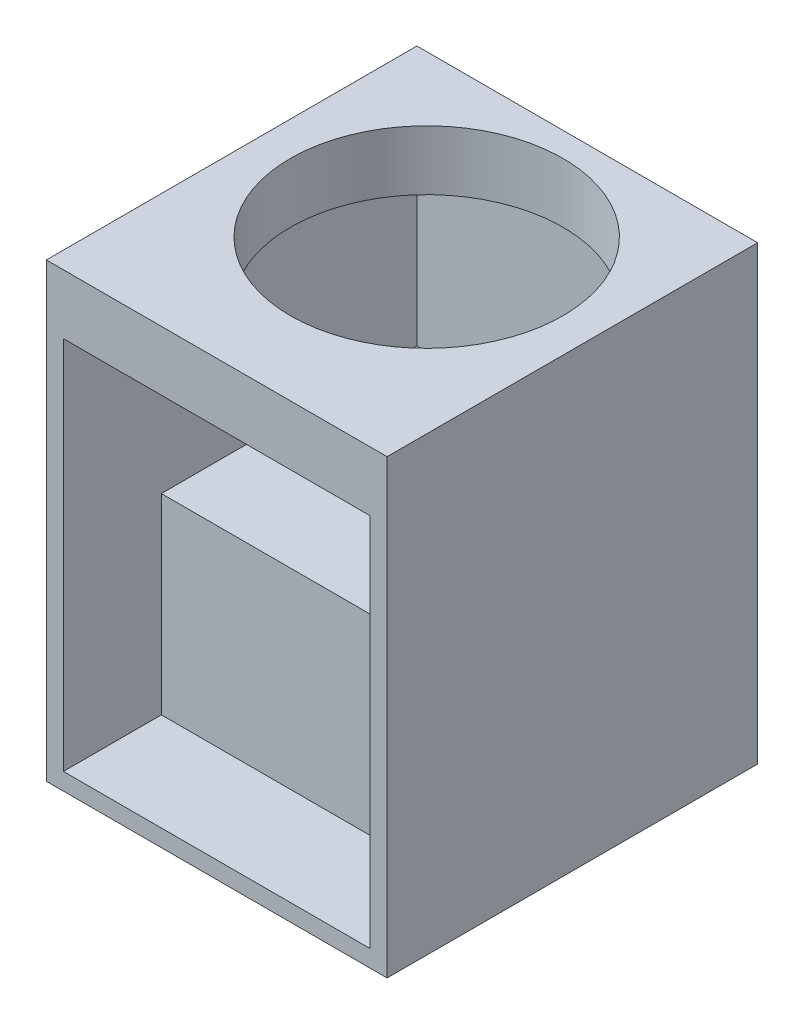
from build123d import *

# Parameters (mm, degrees)
SKETCH1_W           = 400
SKETCH1_H           = 435
BOSS_EXTRUDE1_DEPTH = 480
SKETCH4_W           = 350
SKETCH4_H           = 200
CUT_EXTRUDE1_DEPTH  = 300
SHELL1_START        = -180
SHELL1_DEPTH        = 360
SKETCH5_W           = 400
SKETCH5_H           = 435
BOSS_EXTRUDE2_DEPTH = 50
SKETCH3_R           = 160
CUT_EXTRUDE2_DEPTH  = 70
SKETCH6_R           = 42.5
CUT_EXTRUDE3_DEPTH  = 20


# Read off the part's stored shape, not the designer's step: Shell1
with BuildPart() as part:
    # Sketch1 → Boss-Extrude1 (new body)
    with BuildSketch(Plane(origin=(0, 0, 0), x_dir=(1, 0, 0), z_dir=(0, 1, 0))):
        with Locations((0, -93.5)):
            Rectangle(SKETCH1_W, SKETCH1_H)
    extrude(amount=BOSS_EXTRUDE1_DEPTH)

    # Sketch4 → Cut-Extrude1 (cut)
    with BuildSketch(Plane(origin=(0, 0, -124), x_dir=(-1, 0, 0), z_dir=(0, 0, -1))):
        with Locations((0, 125)):
            Rectangle(SKETCH4_W, SKETCH4_H)
    extrude(amount=-CUT_EXTRUDE1_DEPTH, mode=Mode.SUBTRACT)

    # Shell1 outline → Shell1 (cut)
    with BuildSketch(Plane.YZ.offset(SHELL1_START)):
        Polygon((245, -104), (460, -104), (460, 311), (20, 311), (20, 196), (245, 196), align=None)
    extrude(amount=SHELL1_DEPTH, mode=Mode.SUBTRACT)

    # Sketch5 → Boss-Extrude2 (add)
    with BuildSketch(Plane(origin=(0, 480, 0), x_dir=(1, 0, 0), z_dir=(0, 1, 0))):
        with Locations((0, -93.5)):
            Rectangle(SKETCH5_W, SKETCH5_H)
    extrude(amount=BOSS_EXTRUDE2_DEPTH)

    # Sketch3 → Cut-Extrude2 (cut)
    with BuildSketch(Plane(origin=(0, 530, 0), x_dir=(1, 0, 0), z_dir=(0, 1, 0))):
        with Locations(Location((0, -64.5, 0), (0, 0, 270))):
            Circle(SKETCH3_R)
    extrude(amount=-CUT_EXTRUDE2_DEPTH, mode=Mode.SUBTRACT)

    # Sketch6 → Cut-Extrude3 (cut)
    with BuildSketch(Plane(origin=(0, 245, 0), x_dir=(1, 0, 0), z_dir=(0, 1, 0))):
        with Locations(Location((0, 20, 0), (0, 0, 270))):
            Circle(SKETCH6_R)
    extrude(amount=-CUT_EXTRUDE3_DEPTH, mode=Mode.SUBTRACT)


solid = part.part
